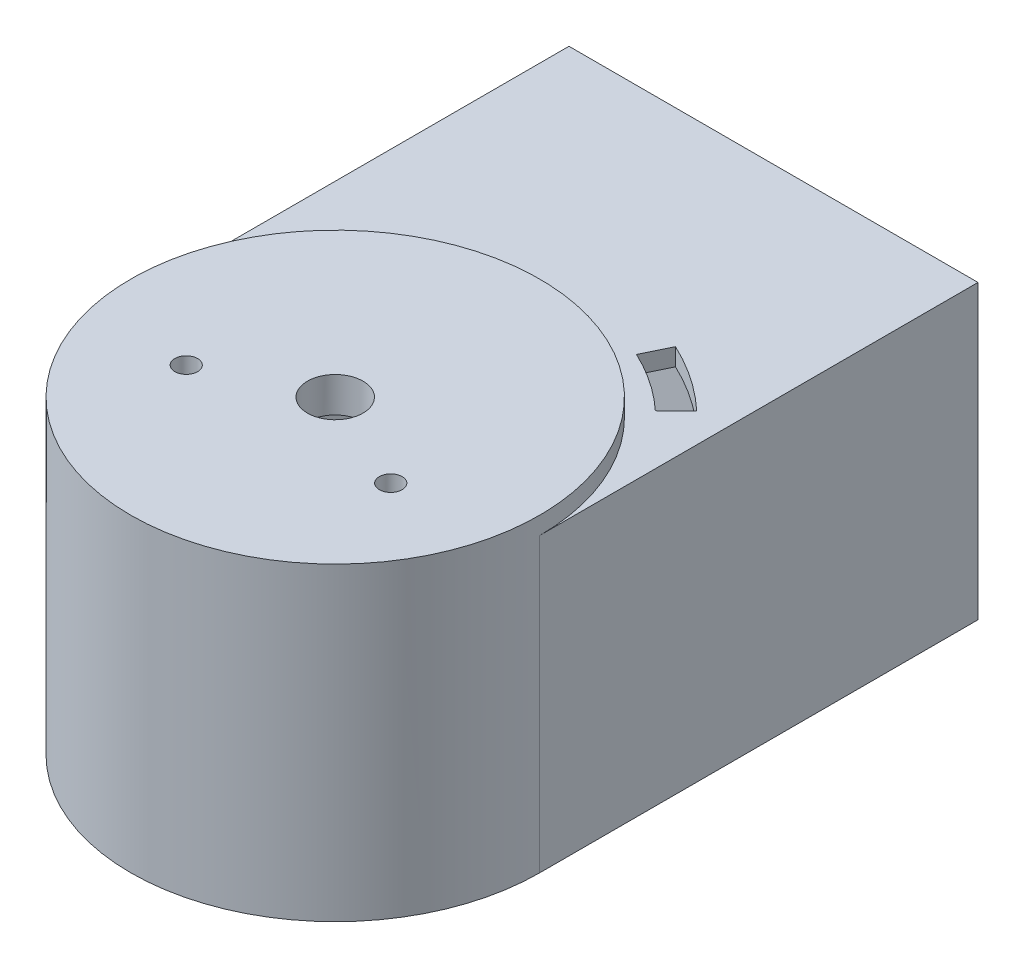
from build123d import *

# Parameters (mm, degrees)
SALIENTE_EXTRUIR1_DEPTH      = 0.0001
SALIENTE_EXTRUIR1_DEPTH_BACK = 3
CROQUIS1_R                   = 35
CROQUIS1_R_2                 = 4.75
CROQUIS2_R                   = 1.95
CORTAR_EXTRUIR1_DEPTH        = 50.588311123
SALIENTE_EXTRUIR3_START      = 50
CROQUIS10_R                  = 4.75
CROQUIS10_R_2                = 1.95
SALIENTE_EXTRUIR3_DEPTH      = 50
CROQUIS11_R                  = 1
CORTAR_EXTRUIR4_DEPTH        = 47
CROQUIS18_R                  = 2.5
CROQUIS18_R_2                = 1.5
SALIENTE_EXTRUIR5_DEPTH      = 5
CORTAR_EXTRUIR6_DEPTH        = 3


with BuildPart() as part:
    # Croquis1 → Saliente-Extruir1 (new, two sides: drawn at the far end of the back side and taken through both)
    with BuildSketch(Plane(origin=(0, 0, 0), x_dir=(1, 0, 0), z_dir=(0, 1, 0)).offset(-SALIENTE_EXTRUIR1_DEPTH_BACK)):
        Circle(CROQUIS1_R)
        Circle(CROQUIS1_R_2, mode=Mode.SUBTRACT)
    extrude(amount=SALIENTE_EXTRUIR1_DEPTH + SALIENTE_EXTRUIR1_DEPTH_BACK)

    # Croquis2 → Cortar-Extruir1 (cut, through all)
    with BuildSketch(Plane.XZ.offset(3)):
        with Locations((-17.5, 8)):
            Circle(CROQUIS2_R)
        with Locations((17.5, 8)):
            Circle(CROQUIS2_R)
    extrude(amount=-CORTAR_EXTRUIR1_DEPTH, mode=Mode.SUBTRACT)

    # Croquis10 → Saliente-Extruir3 (add)
    with BuildSketch(Plane.XZ.offset(3).offset(SALIENTE_EXTRUIR3_START)):
        with BuildLine():
            Line((-35, 0), (-35, -75))
            Line((-35, -75), (35, -75))
            Line((35, -75), (35, 0))
            ThreePointArc((35, 0), (0, 35), (-35, 0))
        make_face()
        Circle(CROQUIS10_R, mode=Mode.SUBTRACT)
        with Locations((-17.5, 8)):
            Circle(CROQUIS10_R_2, mode=Mode.SUBTRACT)
        with Locations((17.5, 8)):
            Circle(CROQUIS10_R_2, mode=Mode.SUBTRACT)
    extrude(amount=-SALIENTE_EXTRUIR3_DEPTH)

    # Croquis11 → Cortar-Extruir4 (cut)
    with BuildSketch(Plane.XZ.offset(53)):
        with Locations((32, -72)):
            Circle(CROQUIS11_R)
        with Locations((-32, -72)):
            Circle(CROQUIS11_R)
        with Locations((6.9e-08, 32)):
            Circle(CROQUIS11_R)
        with BuildLine():
            Line((-32.097608421, 0), (-32, -69.5))
            ThreePointArc((-32, -69.5), (-30.232233047, -70.232233047), (-29.5, -72))
            Line((-29.5, -72), (29.5, -72))
            ThreePointArc((29.5, -72), (30.232233047, -70.232233047), (32, -69.5))
            Line((32, -69.5), (32.097608421, 0))
            ThreePointArc((32.097608421, 0), (23.56418882, 21.79416141), (2.501292998, 31.999999995))
            ThreePointArc((2.501292998, 31.999999995), (6.4e-08, 29.498707071), (-2.50129286, 32.000000005))
            ThreePointArc((-2.50129286, 32.000000005), (-23.564188773, 21.794161461), (-32.097608421, 0))
        make_face()
    extrude(amount=-CORTAR_EXTRUIR4_DEPTH, mode=Mode.SUBTRACT)

    # Croquis18 → Saliente-Extruir5 (add)
    # profile 1 of 8: a face of its own
    with BuildSketch(Plane.XZ.offset(6)):
        with Locations((-27.586090371, -42.438751848)):
            Circle(CROQUIS18_R)
        with Locations((-27.586090371, -42.438751848)):
            Circle(CROQUIS18_R_2, mode=Mode.SUBTRACT)
    # profile 2 of 8: a face of its own
    with BuildSketch(Plane.XZ.offset(6)):
        with Locations((2.413909629, -42.438751848)):
            Circle(CROQUIS18_R)
        with Locations((2.413909629, -42.438751848)):
            Circle(CROQUIS18_R_2, mode=Mode.SUBTRACT)
    # profile 3 of 8: a face of its own
    with BuildSketch(Plane.XZ.offset(6)):
        with Locations((2.413909629, -68.938751848)):
            Circle(CROQUIS18_R)
        with Locations((2.413909629, -68.938751848)):
            Circle(CROQUIS18_R_2, mode=Mode.SUBTRACT)
    # profile 4 of 8: a face of its own
    with BuildSketch(Plane.XZ.offset(6)):
        with Locations((-27.586090371, -68.938751848)):
            Circle(CROQUIS18_R)
        with Locations((-27.586090371, -68.938751848)):
            Circle(CROQUIS18_R_2, mode=Mode.SUBTRACT)
    # profile 5 of 8: a face of its own
    with BuildSketch(Plane.XZ.offset(6)):
        with Locations((-27.586090371, -36.938751848)):
            Circle(CROQUIS18_R)
        with Locations((-27.586090371, -36.938751848)):
            Circle(CROQUIS18_R_2, mode=Mode.SUBTRACT)
    # profile 6 of 8: a face of its own
    with BuildSketch(Plane.XZ.offset(6)):
        with Locations((2.413909629, -36.938751848)):
            Circle(CROQUIS18_R)
        with Locations((2.413909629, -36.938751848)):
            Circle(CROQUIS18_R_2, mode=Mode.SUBTRACT)
    # profile 7 of 8: a face of its own
    with BuildSketch(Plane.XZ.offset(6)):
        with Locations((2.413909629, -10.438751848)):
            Circle(CROQUIS18_R)
        with Locations((2.413909629, -10.438751848)):
            Circle(CROQUIS18_R_2, mode=Mode.SUBTRACT)
    # profile 8 of 8: a face of its own
    with BuildSketch(Plane.XZ.offset(6)):
        with Locations((-27.586090371, -10.438751848)):
            Circle(CROQUIS18_R)
        with Locations((-27.586090371, -10.438751848)):
            Circle(CROQUIS18_R_2, mode=Mode.SUBTRACT)
    extrude(amount=SALIENTE_EXTRUIR5_DEPTH)

    # Croquis19 → Cortar-Extruir6 (cut)
    with BuildSketch(Plane(origin=(0, -3, 0), x_dir=(1, 0, 0), z_dir=(0, 1, 0))):
        with BuildLine():
            Line((16.448187904, 35.100662585), (18.627643672, 39.60106136))
            ThreePointArc((18.627643672, 39.60106136), (24.619655037, 36.181566515), (29.999821685, 31.862891716))
            Line((29.999821685, 31.862891716), (26.408773268, 28.375624993))
            ThreePointArc((26.408773268, 28.375624993), (21.690696459, 32.126516873), (16.448187904, 35.100662585))
        make_face()
    extrude(amount=-CORTAR_EXTRUIR6_DEPTH, mode=Mode.SUBTRACT)


solid = part.part
